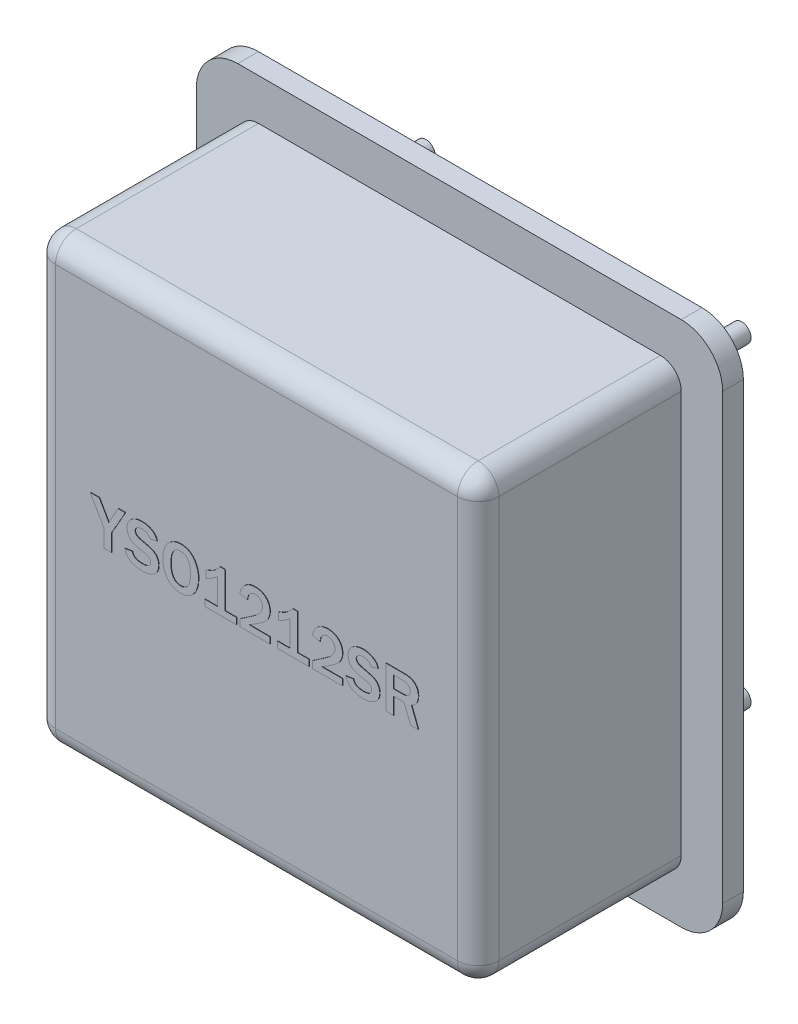
from build123d import *

# Parameters (mm, degrees)
EXTRUDE_1_DEPTH = 0.5
EXTRUDE_2_DEPTH = 4.9
FILLET_1_R      = 0.5
SKETCH_3_R      = 0.225
EXTRUDE_3_DEPTH = 2.5
SKETCH_4_R      = 0.75
EXTRUDE_4_DEPTH = 0.5
FILLET_2_R      = 0.5
WRAP_1_DEPTH    = 0.01


# Read off the part's stored shape, not the designer's step: Перенос1
with BuildPart() as part:
    # Эскиз1 → Бобышка-Вытянуть1 (new body)
    with BuildSketch(Plane.XY):
        with BuildLine():
            Line((-5.35, 6.35), (5.35, 6.35))
            ThreePointArc((5.35, 6.35), (6.057106781, 6.057106781), (6.35, 5.35))
            Line((6.35, 5.35), (6.35, -5.35))
            ThreePointArc((6.35, -5.35), (6.057106781, -6.057106781), (5.35, -6.35))
            Line((5.35, -6.35), (-6.35, -6.35))
            Line((-6.35, -6.35), (-6.35, 5.35))
            ThreePointArc((-6.35, 5.35), (-6.057106781, 6.057106781), (-5.35, 6.35))
        make_face()
    extrude(amount=EXTRUDE_1_DEPTH)

    # Эскиз2 → Бобышка-Вытянуть2 (add)
    with BuildSketch(Plane.XY.offset(0.5)):
        with BuildLine():
            Line((-4.85, 5.35), (4.85, 5.35))
            ThreePointArc((4.85, 5.35), (5.203553391, 5.203553391), (5.35, 4.85))
            Line((5.35, 4.85), (5.35, -4.85))
            ThreePointArc((5.35, -4.85), (5.203553391, -5.203553391), (4.85, -5.35))
            Line((4.85, -5.35), (-4.85, -5.35))
            ThreePointArc((-4.85, -5.35), (-5.203553391, -5.203553391), (-5.35, -4.85))
            Line((-5.35, -4.85), (-5.35, 4.85))
            ThreePointArc((-5.35, 4.85), (-5.203553391, 5.203553391), (-4.85, 5.35))
        make_face()
    extrude(amount=EXTRUDE_2_DEPTH)

    # Скругление1
    fillet_1_edges = [part.edges().sort_by_distance(p)[0] for p in [
        (5.203553391, -5.203553391, 5.4),
        (5.35, 0, 5.4),
        (5.203553391, 5.203553391, 5.4),
        (0, 5.35, 5.4),
        (-5.203553391, 5.203553391, 5.4),
        (-5.35, 0, 5.4),
        (-5.203553391, -5.203553391, 5.4),
        (0, -5.35, 5.4),
    ]]
    fillet(fillet_1_edges, radius=FILLET_1_R)

    # Эскиз3 → Бобышка-Вытянуть3 (add)
    with BuildSketch(Plane(origin=(0, 0, 0), x_dir=(-1, 0, 0), z_dir=(0, 0, -1))):
        with Locations(Location((3.81, -3.81, 0), (0, 0, 180))):
            Circle(SKETCH_3_R)
        with Locations(Location((3.81, 3.81, 0), (0, 0, 180))):
            Circle(SKETCH_3_R)
        with Locations(Location((-3.81, -3.81, 0), (0, 0, 180))):
            Circle(SKETCH_3_R)
        with Locations(Location((-3.81, 3.81, 0), (0, 0, 180))):
            Circle(SKETCH_3_R)
    extrude(amount=EXTRUDE_3_DEPTH)

    # Эскиз4 → Бобышка-Вытянуть4 (add)
    with BuildSketch(Plane(origin=(0, 0, 0), x_dir=(-1, 0, 0), z_dir=(0, 0, -1))):
        with Locations(Location((2.5, -2.15, 0), (0, 0, 180))):
            Circle(SKETCH_4_R)
        with Locations(Location((-2.5, -2.15, 0), (0, 0, 180))):
            Circle(SKETCH_4_R)
        with Locations(Location((0, 2.180127019, 0), (0, 0, 180))):
            Circle(SKETCH_4_R)
    extrude(amount=EXTRUDE_4_DEPTH)

    # Скругление2
    fillet_2_edges = [part.edges().sort_by_distance(p)[0] for p in [
        (-3.25, -2.15, -0.5),
        (1.75, -2.15, -0.5),
        (-0.75, 2.180127019, -0.5),
    ]]
    fillet(fillet_2_edges, radius=FILLET_2_R - 0.0001)  # a hair under: the kernel refuses the full size

    # Перенос1 outline → Перенос1 (add)
    # profile 1 of 9: a face of its own
    with BuildSketch(Plane.XY.offset(5.4)):
        with BuildLine():
            add(Edge.make_bspline(
                [(-2.986111111, -0.205541395), (-2.984703027, -0.211143758), (-2.981915557, -0.222234306), (-2.975864904, -0.238068794), (-2.968090123, -0.252717544), (-2.959313238, -0.266431053), (-2.948882459, -0.278937311), (-2.93724516, -0.290535049), (-2.923776155, -0.300633052), (-2.909324895, -0.310096876), (-2.893210444, -0.318041802), (-2.875896445, -0.325351835), (-2.856970671, -0.330930764), (-2.836846277, -0.336197784), (-2.815165054, -0.339589622), (-2.792173258, -0.342588015), (-2.767738461, -0.343952185), (-2.751013557, -0.344267815), (-2.742404514, -0.344430284)],
                knots=[0, 0, 0, 0, 0.056656455, 0.112158231, 0.165818123, 0.219176659, 0.271620736, 0.325332254, 0.379996961, 0.436510928, 0.494607734, 0.556039301, 0.620703871, 0.688021991, 0.760027589, 0.835837734, 0.915498464, 1, 1, 1, 1], degree=3))
            Line((-2.986111111, -0.205541395), (-3.166666667, -0.233319173))
            add(Edge.make_bspline(
                [(-2.751736111, -0.497208062), (-2.764110633, -0.496966443), (-2.788529481, -0.496489652), (-2.824630575, -0.49370475), (-2.859588786, -0.488782293), (-2.893238195, -0.481498818), (-2.925846185, -0.472667935), (-2.957230248, -0.46159343), (-2.987472, -0.448552519), (-3.016365272, -0.433643986), (-3.043597297, -0.416649458), (-3.068320122, -0.396977926), (-3.090946206, -0.375404973), (-3.111027891, -0.351374956), (-3.128496386, -0.324962932), (-3.144129517, -0.296644428), (-3.156947222, -0.26589491), (-3.163388234, -0.244307186), (-3.166666667, -0.233319173)],
                knots=[0, 0, 0, 0, 0.069752503, 0.137643766, 0.203955587, 0.26857099, 0.331581567, 0.394253518, 0.455983321, 0.517075594, 0.577368024, 0.636589356, 0.69483985, 0.753309691, 0.812679619, 0.873075361, 0.935396176, 1, 1, 1, 1], degree=3))
            add(Edge.make_bspline(
                [(-2.347222222, -0.183840006), (-2.347538263, -0.195723214), (-2.3481543, -0.218886326), (-2.353474783, -0.252692235), (-2.362317744, -0.284471718), (-2.374857764, -0.314323579), (-2.390758215, -0.342273374), (-2.410259093, -0.368262257), (-2.433253851, -0.392326595), (-2.459719085, -0.414102682), (-2.489034471, -0.433441205), (-2.520289135, -0.450725752), (-2.553816333, -0.4651253), (-2.589464636, -0.476676111), (-2.62705902, -0.486145779), (-2.666780055, -0.492504073), (-2.708539615, -0.496511306), (-2.737114257, -0.496972213), (-2.751736111, -0.497208062)],
                knots=[0, 0, 0, 0, 0.061983639, 0.120820401, 0.1780674, 0.233734273, 0.289360173, 0.345456745, 0.402862839, 0.462652237, 0.523901564, 0.585904742, 0.648806961, 0.71398671, 0.78128134, 0.850913491, 0.923711339, 1, 1, 1, 1], degree=3))
            add(Edge.make_bspline(
                [(-2.607421875, 0.095239855), (-2.595014152, 0.091973422), (-2.57110147, 0.085678217), (-2.53706929, 0.074403379), (-2.506313825, 0.06180987), (-2.478524436, 0.04847772), (-2.45401728, 0.033754832), (-2.432942242, 0.017562192), (-2.414542793, 0.000710616), (-2.399758268, -0.017841962), (-2.387504247, -0.037033761), (-2.376728978, -0.05651565), (-2.367525544, -0.076492102), (-2.360286581, -0.097106752), (-2.3542536, -0.118081326), (-2.350189285, -0.139584226), (-2.347768385, -0.161576495), (-2.347405152, -0.176383137), (-2.347222222, -0.183840006)],
                knots=[0, 0, 0, 0, 0.092116656, 0.177531073, 0.257205756, 0.330614787, 0.39867412, 0.462046827, 0.521209535, 0.577346543, 0.631807585, 0.68458034, 0.737112251, 0.789523325, 0.841323381, 0.893685527, 0.946458281, 1, 1, 1, 1], degree=3))
            Line((-2.607421875, 0.095239855), (-2.77734375, 0.137340549))
            add(Edge.make_bspline(
                [(-2.916666667, 0.255396105), (-2.916269492, 0.248611769), (-2.915485562, 0.235221068), (-2.908561518, 0.216051008), (-2.897409674, 0.198477655), (-2.881618182, 0.182836807), (-2.861663953, 0.168878577), (-2.837453939, 0.156561619), (-2.808961336, 0.1458125), (-2.788251664, 0.140263331), (-2.77734375, 0.137340549)],
                knots=[0, 0, 0, 0, 0.102807647, 0.202918366, 0.305679, 0.416820913, 0.538203089, 0.674374599, 0.828491055, 1, 1, 1, 1], degree=3))
            add(Edge.make_bspline(
                [(-2.741970486, 0.377791938), (-2.748848382, 0.377760144), (-2.762194325, 0.377698452), (-2.781586671, 0.375746501), (-2.799844152, 0.373392555), (-2.816767582, 0.369351016), (-2.83248431, 0.364661202), (-2.846965698, 0.358865667), (-2.85998442, 0.351547293), (-2.875600538, 0.341225743), (-2.891862654, 0.325930945), (-2.906115374, 0.304623595), (-2.9152112, 0.280830292), (-2.916173526, 0.264013713), (-2.916666667, 0.255396105)],
                knots=[0, 0, 0, 0, 0.086267162, 0.167393738, 0.24442942, 0.317104737, 0.385455065, 0.450194837, 0.51236268, 0.572543169, 0.684932717, 0.789681103, 0.892222673, 1, 1, 1, 1], degree=3))
            add(Edge.make_bspline(
                [(-2.555555556, 0.266680827), (-2.559167594, 0.275509598), (-2.566205498, 0.292712088), (-2.581523587, 0.315587721), (-2.599994318, 0.335111156), (-2.622083202, 0.350855882), (-2.647413374, 0.363084862), (-2.67603835, 0.371697219), (-2.707926665, 0.37690584), (-2.730303134, 0.377488258), (-2.741970486, 0.377791938)],
                knots=[0, 0, 0, 0, 0.122482514, 0.238652039, 0.351887163, 0.466581876, 0.585638956, 0.712239674, 0.849958408, 1, 1, 1, 1], degree=3))
            Line((-2.555555556, 0.266680827), (-2.388888889, 0.308347494))
            add(Edge.make_bspline(
                [(-2.752604167, 0.530569716), (-2.741891214, 0.530427824), (-2.720716278, 0.530147365), (-2.689347139, 0.527160052), (-2.658833251, 0.522679452), (-2.629152016, 0.51641985), (-2.60047327, 0.508107734), (-2.572638241, 0.498111963), (-2.545605635, 0.486415709), (-2.519766807, 0.472764364), (-2.495263745, 0.457823252), (-2.473023163, 0.440958229), (-2.452922031, 0.422828534), (-2.435459435, 0.402835509), (-2.420195497, 0.381466578), (-2.407056342, 0.358655027), (-2.396578147, 0.334127097), (-2.391473128, 0.317011615), (-2.388888889, 0.308347494)],
                knots=[0, 0, 0, 0, 0.070067612, 0.138493765, 0.205959035, 0.271768989, 0.336775966, 0.401145877, 0.465152901, 0.529294502, 0.592202089, 0.652684629, 0.71164265, 0.768984917, 0.825980465, 0.883213263, 0.940880749, 1, 1, 1, 1], degree=3))
            add(Edge.make_bspline(
                [(-3.111111111, 0.226967285), (-3.110859993, 0.238199634), (-3.110369912, 0.260120678), (-3.105347953, 0.292100068), (-3.097694804, 0.322443015), (-3.086480776, 0.351013678), (-3.072361228, 0.377982258), (-3.054727968, 0.403015799), (-3.034353993, 0.426659442), (-3.010544587, 0.447934082), (-2.984676049, 0.467401329), (-2.956778913, 0.484524021), (-2.926878656, 0.498453247), (-2.895454551, 0.51037159), (-2.862221676, 0.519373241), (-2.827248807, 0.525894435), (-2.790528439, 0.529856788), (-2.76541793, 0.530328834), (-2.752604167, 0.530569716)],
                knots=[0, 0, 0, 0, 0.06383965, 0.124589417, 0.183667869, 0.241508339, 0.298748618, 0.35638825, 0.415298831, 0.47588396, 0.537601361, 0.599274858, 0.661666101, 0.724943745, 0.790224303, 0.857203403, 0.927131637, 1, 1, 1, 1], degree=3))
            add(Edge.make_bspline(
                [(-2.860026042, -0.057103895), (-2.875564765, -0.052736166), (-2.90465406, -0.044559551), (-2.944754037, -0.030238306), (-2.978475048, -0.01514703), (-3.006514424, 0.001525324), (-3.029965576, 0.020572727), (-3.049941477, 0.042955693), (-3.068173284, 0.068167692), (-3.083346768, 0.096780218), (-3.095634735, 0.127571076), (-3.104485583, 0.15981657), (-3.11020428, 0.193054624), (-3.110806794, 0.215586775), (-3.111111111, 0.226967285)],
                knots=[0, 0, 0, 0, 0.116476583, 0.21805019, 0.307066431, 0.382731705, 0.452862203, 0.524195224, 0.598669358, 0.676927554, 0.757304679, 0.837489942, 0.917919621, 1, 1, 1, 1], degree=3))
            Line((-2.860026042, -0.057103895), (-2.666883681, -0.09920459))
            add(Edge.make_bspline(
                [(-2.541666667, -0.220732367), (-2.541972804, -0.214487169), (-2.542581854, -0.202062548), (-2.547080739, -0.183778017), (-2.554569311, -0.166288707), (-2.563180197, -0.152425169), (-2.572125226, -0.141976219), (-2.580582698, -0.134349689), (-2.590995974, -0.127563678), (-2.602718477, -0.120628267), (-2.616444755, -0.114767493), (-2.631751469, -0.109137854), (-2.648631593, -0.103604153), (-2.660638764, -0.100709892), (-2.666883681, -0.09920459)],
                knots=[0, 0, 0, 0, 0.097850119, 0.194669652, 0.293246512, 0.395184179, 0.44906011, 0.50848649, 0.572967504, 0.643579243, 0.721762348, 0.806444209, 0.899331843, 1, 1, 1, 1], degree=3))
            add(Edge.make_bspline(
                [(-2.742404514, -0.344430284), (-2.734590713, -0.344268685), (-2.719382705, -0.343954163), (-2.697261594, -0.342579327), (-2.676545615, -0.339690236), (-2.657242377, -0.335865446), (-2.63931987, -0.330860412), (-2.622762159, -0.324789972), (-2.607528949, -0.317691797), (-2.593817003, -0.309417949), (-2.58164126, -0.300285015), (-2.570985726, -0.290576914), (-2.561947224, -0.280247049), (-2.554507414, -0.269426432), (-2.548851346, -0.25799478), (-2.544590245, -0.246157521), (-2.542204706, -0.23363115), (-2.541848107, -0.22508215), (-2.541666667, -0.220732367)],
                knots=[0, 0, 0, 0, 0.089511101, 0.174215532, 0.253655289, 0.328883544, 0.399441257, 0.466543583, 0.53065905, 0.591613395, 0.64960748, 0.704725214, 0.756397831, 0.806492182, 0.854658561, 0.902085367, 0.950180442, 1, 1, 1, 1], degree=3))
        make_face()
    # profile 2 of 9: a face of its own
    with BuildSketch(Plane.XY.offset(5.4)):
        with BuildLine():
            add(Edge.make_bspline(
                [(-2.25, 0.019936035), (-2.249602085, 0.037744558), (-2.24882216, 0.072649845), (-2.24336955, 0.123899627), (-2.234115815, 0.172928317), (-2.220746375, 0.219691607), (-2.204120729, 0.264353208), (-2.183620114, 0.306752501), (-2.159157955, 0.346780218), (-2.131389463, 0.384364876), (-2.100547397, 0.418593081), (-2.0669495, 0.448644799), (-2.03074927, 0.473880029), (-1.992270196, 0.494724255), (-1.951384189, 0.510841963), (-1.908151491, 0.522388423), (-1.862481646, 0.529152355), (-1.831258104, 0.530090748), (-1.815321181, 0.530569716)],
                knots=[0, 0, 0, 0, 0.071125345, 0.139408001, 0.205594729, 0.270167463, 0.333439417, 0.395725999, 0.457964312, 0.520548402, 0.582121204, 0.641675985, 0.700189245, 0.75797679, 0.816084163, 0.8753072, 0.936355088, 1, 1, 1, 1], degree=3))
            add(Edge.make_bspline(
                [(-1.823567708, -0.497208062), (-1.839943553, -0.496762162), (-1.871908019, -0.495891797), (-1.918385874, -0.488742109), (-1.962220666, -0.477475092), (-2.002996519, -0.460630717), (-2.041351429, -0.439921436), (-2.076492307, -0.413868816), (-2.109098681, -0.38355586), (-2.138378166, -0.348589686), (-2.164371459, -0.31020632), (-2.187547533, -0.269604513), (-2.206921006, -0.226654835), (-2.222465475, -0.181481133), (-2.234897651, -0.13427391), (-2.243787932, -0.084797301), (-2.249024569, -0.033129477), (-2.249671344, 0.00205647), (-2.25, 0.019936035)],
                knots=[0, 0, 0, 0, 0.065202683, 0.127270924, 0.186893503, 0.245060999, 0.302579602, 0.360101092, 0.418820591, 0.479552624, 0.541337256, 0.603279609, 0.665572875, 0.72872865, 0.793382023, 0.859854191, 0.928785597, 1, 1, 1, 1], degree=3))
            add(Edge.make_bspline(
                [(-1.388888889, 0.017765896), (-1.389284748, -0.001054276), (-1.390056853, -0.03776223), (-1.395468885, -0.091475409), (-1.404807867, -0.14241125), (-1.417731955, -0.19065894), (-1.434481727, -0.23618984), (-1.455204638, -0.278765282), (-1.479313648, -0.318819371), (-1.507254408, -0.355561049), (-1.538186675, -0.388690096), (-1.571588747, -0.417883448), (-1.607479249, -0.442609995), (-1.646168098, -0.462405451), (-1.687017878, -0.478154293), (-1.730439143, -0.489139236), (-1.776178076, -0.496090681), (-1.80755522, -0.49683051), (-1.823567708, -0.497208062)],
                knots=[0, 0, 0, 0, 0.074502731, 0.14531444, 0.213448803, 0.279305653, 0.342822724, 0.405198466, 0.466492606, 0.527606518, 0.587580546, 0.645636819, 0.702908012, 0.759649061, 0.817301328, 0.875854836, 0.936645827, 1, 1, 1, 1], degree=3))
            add(Edge.make_bspline(
                [(-1.815321181, 0.530569716), (-1.799312872, 0.530087325), (-1.767947213, 0.529142158), (-1.722188712, 0.522445666), (-1.67904383, 0.510824414), (-1.638463231, 0.494816851), (-1.600562053, 0.473917177), (-1.565201839, 0.448608443), (-1.53246359, 0.418627619), (-1.502727607, 0.384311198), (-1.475925606, 0.346727815), (-1.452714339, 0.306383622), (-1.432837667, 0.263955562), (-1.416756154, 0.219108879), (-1.404156712, 0.172002944), (-1.39541902, 0.12255271), (-1.389767021, 0.07092116), (-1.38918551, 0.03572104), (-1.388888889, 0.017765896)],
                knots=[0, 0, 0, 0, 0.064146068, 0.125683714, 0.18482368, 0.242854803, 0.300070672, 0.357831807, 0.416723283, 0.477537663, 0.539477544, 0.601432348, 0.663814321, 0.726996098, 0.792111536, 0.858982425, 0.928068687, 1, 1, 1, 1], degree=3))
        make_face()
        with BuildLine():
            add(Edge.make_bspline(
                [(-1.583333333, 0.019284994), (-1.583497722, 0.032888129), (-1.583818072, 0.059397143), (-1.586363174, 0.098022372), (-1.59094858, 0.134382123), (-1.597143152, 0.168466749), (-1.605199849, 0.200291442), (-1.6148174, 0.229913037), (-1.626643399, 0.257161734), (-1.640000035, 0.282158073), (-1.655156898, 0.304785566), (-1.672514249, 0.324369703), (-1.691935539, 0.340964583), (-1.713288502, 0.354457313), (-1.736675951, 0.36497986), (-1.761960819, 0.372626235), (-1.789350999, 0.376910024), (-1.808217455, 0.377492315), (-1.817925347, 0.377791938)],
                knots=[0, 0, 0, 0, 0.084326336, 0.16433035, 0.239810088, 0.311406626, 0.378949026, 0.443189149, 0.504251522, 0.562839855, 0.618686746, 0.672686415, 0.724537347, 0.776541251, 0.828722736, 0.883058393, 0.939826723, 1, 1, 1, 1], degree=3))
            add(Edge.make_bspline(
                [(-1.821614583, -0.344430284), (-1.813425102, -0.34417673), (-1.797323277, -0.343678202), (-1.773690016, -0.339832136), (-1.750924338, -0.333843067), (-1.729260481, -0.32501059), (-1.708282207, -0.314170061), (-1.688671572, -0.300346993), (-1.669804256, -0.284352561), (-1.651817858, -0.265857778), (-1.635321778, -0.243954041), (-1.621228917, -0.218068287), (-1.609594879, -0.188110154), (-1.599973932, -0.15431442), (-1.592427336, -0.116502766), (-1.587157825, -0.074805429), (-1.583884559, -0.029089141), (-1.583522164, 0.002713674), (-1.583333333, 0.019284994)],
                knots=[0, 0, 0, 0, 0.049960708, 0.098230702, 0.145782593, 0.193334483, 0.2407324, 0.289598405, 0.339402802, 0.39154752, 0.446736047, 0.50621525, 0.57082044, 0.642504028, 0.720432417, 0.805917575, 0.898870521, 1, 1, 1, 1], degree=3))
            add(Edge.make_bspline(
                [(-2.055555556, 0.01407666), (-2.055414964, -0.000178821), (-2.055142046, -0.027851675), (-2.052301301, -0.067989207), (-2.047592874, -0.105536387), (-2.040888356, -0.140395486), (-2.03256183, -0.172666426), (-2.022082541, -0.202215073), (-2.009782753, -0.229114), (-1.995714643, -0.253462517), (-1.97956609, -0.274781659), (-1.961925535, -0.293410182), (-1.942662832, -0.309254908), (-1.921633763, -0.322178319), (-1.898906852, -0.332160839), (-1.874581461, -0.339429342), (-1.848587394, -0.343483743), (-1.830742641, -0.344109959), (-1.821614583, -0.344430284)],
                knots=[0, 0, 0, 0, 0.088592987, 0.171977415, 0.249941733, 0.323659878, 0.392474925, 0.456895932, 0.518256837, 0.576091754, 0.631305128, 0.684096475, 0.735218646, 0.785882027, 0.837012106, 0.88907856, 0.943260784, 1, 1, 1, 1], degree=3))
            add(Edge.make_bspline(
                [(-1.817925347, 0.377791938), (-1.827559359, 0.377476161), (-1.846267725, 0.376862951), (-1.873414328, 0.372812525), (-1.898611997, 0.365558158), (-1.922006676, 0.35559795), (-1.943515583, 0.342620484), (-1.963177051, 0.326827197), (-1.98111186, 0.30833687), (-1.99674963, 0.286718875), (-2.010717088, 0.26243068), (-2.022775956, 0.235283625), (-2.032963147, 0.205263056), (-2.041348943, 0.172543879), (-2.047858897, 0.136938992), (-2.052227697, 0.098510316), (-2.055165628, 0.05723577), (-2.055422835, 0.028766789), (-2.055555556, 0.01407666)],
                knots=[0, 0, 0, 0, 0.058737271, 0.114062397, 0.166826911, 0.218192389, 0.268640894, 0.319471569, 0.371559004, 0.425190037, 0.481697829, 0.54210513, 0.605981978, 0.674761805, 0.747855996, 0.826464593, 0.910454911, 1, 1, 1, 1], degree=3))
        make_face(mode=Mode.SUBTRACT)
    # profile 3 of 9: a face of its own
    with BuildSketch(Plane.XY.offset(5.4)):
        with BuildLine():
            add(Edge.make_bspline(
                [(-0.930555556, 0.294241591), (-0.942944983, 0.283690121), (-0.967169302, 0.263059451), (-1.003502312, 0.233918043), (-1.039226876, 0.207755007), (-1.07372786, 0.183581227), (-1.107721672, 0.162446221), (-1.140824815, 0.143737145), (-1.17280592, 0.127186482), (-1.194379698, 0.118246469), (-1.204861111, 0.113903049)],
                knots=[0, 0, 0, 0, 0.148058968, 0.289491008, 0.423624862, 0.550871495, 0.672677906, 0.787617792, 0.896816138, 1, 1, 1, 1], degree=3))
            Line((-0.930555556, 0.294241591), (-0.930555556, -0.330541395))
            Line((-0.930555556, -0.330541395), (-1.236111111, -0.330541395))
            Line((-1.236111111, -0.330541395), (-1.236111111, -0.483319173))
            Line((-1.236111111, -0.483319173), (-0.472222222, -0.483319173))
            Line((-0.472222222, -0.483319173), (-0.472222222, -0.330541395))
            Line((-0.472222222, -0.330541395), (-0.75, -0.330541395))
            Line((-0.75, -0.330541395), (-0.75, 0.530569716))
            Line((-0.75, 0.530569716), (-0.870225694, 0.530569716))
            add(Edge.make_bspline(
                [(-1.204861111, 0.294458605), (-1.19488116, 0.298227048), (-1.175927128, 0.305384115), (-1.148914187, 0.315462843), (-1.125025516, 0.325089261), (-1.103981132, 0.333781184), (-1.085709191, 0.341422838), (-1.070626332, 0.348682288), (-1.0582516, 0.354635724), (-1.045120111, 0.362335337), (-1.028978153, 0.37349786), (-1.007907349, 0.389825888), (-0.983034425, 0.410184845), (-0.955654579, 0.43356997), (-0.9283494, 0.458331772), (-0.904731787, 0.483405251), (-0.884939714, 0.506757976), (-0.874903888, 0.522998983), (-0.870225694, 0.530569716)],
                knots=[0, 0, 0, 0, 0.076578495, 0.145438706, 0.206959063, 0.261443328, 0.308899468, 0.349085426, 0.381597164, 0.407425535, 0.458266745, 0.522348273, 0.598745212, 0.688975075, 0.780844148, 0.863122565, 0.936194682, 1, 1, 1, 1], degree=3))
            Line((-1.204861111, 0.294458605), (-1.204861111, 0.113903049))
        make_face()
    # profile 4 of 9: a face of its own
    with BuildSketch(Plane.XY.offset(5.4)):
        with BuildLine():
            add(Edge.make_bspline(
                [(-0.084201389, -0.109404242), (-0.072795673, -0.101515208), (-0.050715973, -0.08624326), (-0.01955958, -0.063037274), (0.008871174, -0.040686988), (0.034165829, -0.018837017), (0.056660309, 0.002257746), (0.076277574, 0.022574321), (0.092893064, 0.042370853), (0.110670047, 0.067231457), (0.128038352, 0.097438481), (0.143797914, 0.132581346), (0.153670819, 0.166538725), (0.154971666, 0.188859875), (0.155598958, 0.199623535)],
                knots=[0, 0, 0, 0, 0.102488525, 0.198401914, 0.287074603, 0.369708942, 0.44535091, 0.514926661, 0.578313457, 0.636174539, 0.740618928, 0.835181779, 0.920521691, 1, 1, 1, 1], degree=3))
            Line((-0.084201389, -0.109404242), (-0.388888889, -0.316652506))
            Line((-0.388888889, -0.316652506), (-0.388888889, -0.483319173))
            Line((-0.388888889, -0.483319173), (0.333333333, -0.483319173))
            Line((0.333333333, -0.483319173), (0.333333333, -0.330541395))
            Line((0.333333333, -0.330541395), (-0.165798611, -0.330541395))
            add(Edge.make_bspline(
                [(0.336154514, 0.196585341), (0.33590307, 0.186013376), (0.335405321, 0.165085549), (0.331468199, 0.134110601), (0.324593133, 0.104116703), (0.31561615, 0.074811387), (0.30340477, 0.046576287), (0.289255982, 0.018863371), (0.271869375, -0.00764057), (0.255352161, -0.029136214), (0.240178263, -0.046390066), (0.226584778, -0.06002637), (0.211233976, -0.07457456), (0.193754107, -0.089720772), (0.174503814, -0.105796868), (0.153219351, -0.12240657), (0.130105887, -0.139894366), (0.104929611, -0.158027931), (0.07786023, -0.177139656), (0.048771542, -0.196885114), (0.017686183, -0.2171698), (-0.01506973, -0.238613649), (-0.050070066, -0.26039873), (-0.086854478, -0.283171242), (-0.125620381, -0.306696934), (-0.152185414, -0.322462409), (-0.165798611, -0.330541395)],
                knots=[0, 0, 0, 0, 0.041495428, 0.082142639, 0.122307868, 0.162185965, 0.202270804, 0.242915039, 0.284189302, 0.326505472, 0.349239486, 0.37434042, 0.402062602, 0.432249619, 0.465118487, 0.500510775, 0.538222901, 0.578893913, 0.622305037, 0.668302943, 0.716899285, 0.768018831, 0.821990626, 0.878732468, 0.937856699, 1, 1, 1, 1], degree=3))
            add(Edge.make_bspline(
                [(-0.019965278, 0.530569716), (-0.006787747, 0.530272378), (0.018989788, 0.529690735), (0.056682239, 0.525308018), (0.092381773, 0.518029442), (0.12593597, 0.507549637), (0.157485597, 0.494307136), (0.186867056, 0.477883847), (0.214439775, 0.458802433), (0.239442469, 0.436563545), (0.262239746, 0.412405255), (0.28209545, 0.386321977), (0.298621172, 0.35849138), (0.312468874, 0.329267841), (0.323075557, 0.298316471), (0.330643679, 0.265819006), (0.335333026, 0.231733645), (0.335876884, 0.208464076), (0.336154514, 0.196585341)],
                knots=[0, 0, 0, 0, 0.072015998, 0.140875782, 0.207100257, 0.2708811, 0.332716646, 0.393780021, 0.454548246, 0.515624421, 0.576327007, 0.635875079, 0.694395607, 0.752942845, 0.812338446, 0.872856601, 0.935095366, 1, 1, 1, 1], degree=3))
            add(Edge.make_bspline(
                [(-0.388888889, 0.211125271), (-0.387040987, 0.221941015), (-0.383374683, 0.24339984), (-0.374799288, 0.274672939), (-0.363970362, 0.304744751), (-0.350613381, 0.333531755), (-0.334971054, 0.3612574), (-0.316672212, 0.387649448), (-0.296139857, 0.413029867), (-0.27334441, 0.436990458), (-0.248271561, 0.458874144), (-0.221191531, 0.478131105), (-0.192255245, 0.494444005), (-0.161427593, 0.507796276), (-0.12865599, 0.517933439), (-0.094094365, 0.525314006), (-0.05762074, 0.529689324), (-0.032708722, 0.530271772), (-0.019965278, 0.530569716)],
                knots=[0, 0, 0, 0, 0.061474734, 0.121968095, 0.181484621, 0.240447441, 0.299644032, 0.359705053, 0.42024596, 0.482480917, 0.544847828, 0.60650283, 0.668415966, 0.730710337, 0.794448858, 0.860378466, 0.928578281, 1, 1, 1, 1], degree=3))
            Line((-0.388888889, 0.211125271), (-0.208333333, 0.169458605))
            add(Edge.make_bspline(
                [(-0.016276042, 0.377791938), (-0.023082466, 0.377616298), (-0.036304643, 0.377275099), (-0.05564632, 0.374879181), (-0.073802583, 0.370763144), (-0.090950421, 0.365155569), (-0.106830686, 0.357679941), (-0.121762821, 0.348785304), (-0.135431212, 0.338037635), (-0.148172982, 0.325820732), (-0.159607806, 0.311824279), (-0.170184852, 0.29637898), (-0.179118333, 0.27904402), (-0.187544433, 0.260383599), (-0.194327166, 0.239898976), (-0.200216506, 0.217875955), (-0.204979643, 0.194242557), (-0.2071959, 0.177864297), (-0.208333333, 0.169458605)],
                knots=[0, 0, 0, 0, 0.064616556, 0.125524294, 0.184671911, 0.241139137, 0.296445882, 0.350979668, 0.405793836, 0.461164507, 0.518234122, 0.577093953, 0.63854139, 0.703114134, 0.771310552, 0.843111998, 0.919481536, 1, 1, 1, 1], degree=3))
            add(Edge.make_bspline(
                [(0.155598958, 0.199623535), (0.15551753, 0.205781778), (0.155356894, 0.217930398), (0.152783685, 0.235695222), (0.149171358, 0.252785991), (0.143972093, 0.269087815), (0.137159026, 0.284620244), (0.128935915, 0.29941681), (0.119045903, 0.313395976), (0.107822337, 0.326503467), (0.095611228, 0.338644089), (0.08230061, 0.349155759), (0.067951559, 0.357885588), (0.052881106, 0.365265173), (0.036811359, 0.371028062), (0.019885825, 0.374784316), (0.002099453, 0.377292382), (-0.010045961, 0.377622567), (-0.016276042, 0.377791938)],
                knots=[0, 0, 0, 0, 0.06659456, 0.131373857, 0.193879822, 0.255536535, 0.31619585, 0.377187768, 0.438445469, 0.501205922, 0.563770706, 0.624546135, 0.684304329, 0.745235909, 0.805910381, 0.86858775, 0.932591105, 1, 1, 1, 1], degree=3))
        make_face()
    # profile 5 of 9: a face of its own
    with BuildSketch(Plane.XY.offset(5.4)):
        with BuildLine():
            add(Edge.make_bspline(
                [(0.819444444, 0.294241591), (0.807055017, 0.283690121), (0.782830698, 0.263059451), (0.746497688, 0.233918043), (0.710773124, 0.207755007), (0.67627214, 0.183581227), (0.642278328, 0.162446221), (0.609175185, 0.143737145), (0.57719408, 0.127186482), (0.555620302, 0.118246469), (0.545138889, 0.113903049)],
                knots=[0, 0, 0, 0, 0.148058968, 0.289491008, 0.423624862, 0.550871495, 0.672677906, 0.787617792, 0.896816138, 1, 1, 1, 1], degree=3))
            Line((0.819444444, 0.294241591), (0.819444444, -0.330541395))
            Line((0.819444444, -0.330541395), (0.513888889, -0.330541395))
            Line((0.513888889, -0.330541395), (0.513888889, -0.483319173))
            Line((0.513888889, -0.483319173), (1.277777778, -0.483319173))
            Line((1.277777778, -0.483319173), (1.277777778, -0.330541395))
            Line((1.277777778, -0.330541395), (1, -0.330541395))
            Line((1, -0.330541395), (1, 0.530569716))
            Line((1, 0.530569716), (0.879774306, 0.530569716))
            add(Edge.make_bspline(
                [(0.545138889, 0.294458605), (0.55511884, 0.298227048), (0.574072872, 0.305384115), (0.601085813, 0.315462843), (0.624974484, 0.325089261), (0.646018868, 0.333781184), (0.664290809, 0.341422838), (0.679373668, 0.348682288), (0.6917484, 0.354635724), (0.704879889, 0.362335337), (0.721021847, 0.37349786), (0.742092651, 0.389825888), (0.766965575, 0.410184845), (0.794345421, 0.43356997), (0.8216506, 0.458331772), (0.845268213, 0.483405251), (0.865060286, 0.506757976), (0.875096112, 0.522998983), (0.879774306, 0.530569716)],
                knots=[0, 0, 0, 0, 0.076578495, 0.145438706, 0.206959063, 0.261443328, 0.308899468, 0.349085426, 0.381597164, 0.407425535, 0.458266745, 0.522348273, 0.598745212, 0.688975075, 0.780844148, 0.863122565, 0.936194682, 1, 1, 1, 1], degree=3))
            Line((0.545138889, 0.294458605), (0.545138889, 0.113903049))
        make_face()
    # profile 6 of 9: a face of its own
    with BuildSketch(Plane.XY.offset(5.4)):
        with BuildLine():
            add(Edge.make_bspline(
                [(1.665798611, -0.109404242), (1.677204327, -0.101515208), (1.699284027, -0.08624326), (1.73044042, -0.063037274), (1.758871174, -0.040686988), (1.784165829, -0.018837017), (1.806660309, 0.002257746), (1.826277574, 0.022574321), (1.842893064, 0.042370853), (1.860670047, 0.067231457), (1.878038352, 0.097438481), (1.893797914, 0.132581346), (1.903670819, 0.166538725), (1.904971666, 0.188859875), (1.905598958, 0.199623535)],
                knots=[0, 0, 0, 0, 0.102488525, 0.198401914, 0.287074603, 0.369708942, 0.44535091, 0.514926661, 0.578313457, 0.636174539, 0.740618928, 0.835181779, 0.920521691, 1, 1, 1, 1], degree=3))
            Line((1.665798611, -0.109404242), (1.361111111, -0.316652506))
            Line((1.361111111, -0.316652506), (1.361111111, -0.483319173))
            Line((1.361111111, -0.483319173), (2.083333333, -0.483319173))
            Line((2.083333333, -0.483319173), (2.083333333, -0.330541395))
            Line((2.083333333, -0.330541395), (1.584201389, -0.330541395))
            add(Edge.make_bspline(
                [(2.086154514, 0.196585341), (2.08590307, 0.186013376), (2.085405321, 0.165085549), (2.081468199, 0.134110601), (2.074593133, 0.104116703), (2.06561615, 0.074811387), (2.05340477, 0.046576287), (2.039255982, 0.018863371), (2.021869375, -0.00764057), (2.005352161, -0.029136214), (1.990178263, -0.046390066), (1.976584778, -0.06002637), (1.961233976, -0.07457456), (1.943754107, -0.089720772), (1.924503814, -0.105796868), (1.903219351, -0.12240657), (1.880105887, -0.139894366), (1.854929611, -0.158027931), (1.82786023, -0.177139656), (1.798771542, -0.196885114), (1.767686183, -0.2171698), (1.73493027, -0.238613649), (1.699929934, -0.26039873), (1.663145522, -0.283171242), (1.624379619, -0.306696934), (1.597814586, -0.322462409), (1.584201389, -0.330541395)],
                knots=[0, 0, 0, 0, 0.041495428, 0.082142639, 0.122307868, 0.162185965, 0.202270804, 0.242915039, 0.284189302, 0.326505472, 0.349239486, 0.37434042, 0.402062602, 0.432249619, 0.465118487, 0.500510775, 0.538222901, 0.578893913, 0.622305037, 0.668302943, 0.716899285, 0.768018831, 0.821990626, 0.878732468, 0.937856699, 1, 1, 1, 1], degree=3))
            add(Edge.make_bspline(
                [(1.730034722, 0.530569716), (1.743212253, 0.530272378), (1.768989788, 0.529690735), (1.806682239, 0.525308018), (1.842381773, 0.518029442), (1.87593597, 0.507549637), (1.907485597, 0.494307136), (1.936867056, 0.477883847), (1.964439775, 0.458802433), (1.989442469, 0.436563545), (2.012239746, 0.412405255), (2.03209545, 0.386321977), (2.048621172, 0.35849138), (2.062468874, 0.329267841), (2.073075557, 0.298316471), (2.080643679, 0.265819006), (2.085333026, 0.231733645), (2.085876884, 0.208464076), (2.086154514, 0.196585341)],
                knots=[0, 0, 0, 0, 0.072015998, 0.140875782, 0.207100257, 0.2708811, 0.332716646, 0.393780021, 0.454548246, 0.515624421, 0.576327007, 0.635875079, 0.694395607, 0.752942845, 0.812338446, 0.872856601, 0.935095366, 1, 1, 1, 1], degree=3))
            add(Edge.make_bspline(
                [(1.361111111, 0.211125271), (1.362959013, 0.221941015), (1.366625317, 0.24339984), (1.375200712, 0.274672939), (1.386029638, 0.304744751), (1.399386619, 0.333531755), (1.415028946, 0.3612574), (1.433327788, 0.387649448), (1.453860143, 0.413029867), (1.47665559, 0.436990458), (1.501728439, 0.458874144), (1.528808469, 0.478131105), (1.557744755, 0.494444005), (1.588572407, 0.507796276), (1.62134401, 0.517933439), (1.655905635, 0.525314006), (1.69237926, 0.529689324), (1.717291278, 0.530271772), (1.730034722, 0.530569716)],
                knots=[0, 0, 0, 0, 0.061474734, 0.121968095, 0.181484621, 0.240447441, 0.299644032, 0.359705053, 0.42024596, 0.482480917, 0.544847828, 0.60650283, 0.668415966, 0.730710337, 0.794448858, 0.860378466, 0.928578281, 1, 1, 1, 1], degree=3))
            Line((1.361111111, 0.211125271), (1.541666667, 0.169458605))
            add(Edge.make_bspline(
                [(1.733723958, 0.377791938), (1.726917534, 0.377616298), (1.713695357, 0.377275099), (1.69435368, 0.374879181), (1.676197417, 0.370763144), (1.659049579, 0.365155569), (1.643169314, 0.357679941), (1.628237179, 0.348785304), (1.614568788, 0.338037635), (1.601827018, 0.325820732), (1.590392194, 0.311824279), (1.579815148, 0.29637898), (1.570881667, 0.27904402), (1.562455567, 0.260383599), (1.555672834, 0.239898976), (1.549783494, 0.217875955), (1.545020357, 0.194242557), (1.5428041, 0.177864297), (1.541666667, 0.169458605)],
                knots=[0, 0, 0, 0, 0.064616556, 0.125524294, 0.184671911, 0.241139137, 0.296445882, 0.350979668, 0.405793836, 0.461164507, 0.518234122, 0.577093953, 0.63854139, 0.703114134, 0.771310552, 0.843111998, 0.919481536, 1, 1, 1, 1], degree=3))
            add(Edge.make_bspline(
                [(1.905598958, 0.199623535), (1.90551753, 0.205781778), (1.905356894, 0.217930398), (1.902783685, 0.235695222), (1.899171358, 0.252785991), (1.893972093, 0.269087815), (1.887159026, 0.284620244), (1.878935915, 0.29941681), (1.869045903, 0.313395976), (1.857822337, 0.326503467), (1.845611228, 0.338644089), (1.83230061, 0.349155759), (1.817951559, 0.357885588), (1.802881106, 0.365265173), (1.786811359, 0.371028062), (1.769885825, 0.374784316), (1.752099453, 0.377292382), (1.739954039, 0.377622567), (1.733723958, 0.377791938)],
                knots=[0, 0, 0, 0, 0.06659456, 0.131373857, 0.193879822, 0.255536535, 0.31619585, 0.377187768, 0.438445469, 0.501205922, 0.563770706, 0.624546135, 0.684304329, 0.745235909, 0.805910381, 0.86858775, 0.932591105, 1, 1, 1, 1], degree=3))
        make_face()
    # profile 7 of 9: a face of its own
    with BuildSketch(Plane.XY.offset(5.4)):
        with BuildLine():
            add(Edge.make_bspline(
                [(2.347222222, -0.205541395), (2.348630306, -0.211143758), (2.351417776, -0.222234306), (2.35746843, -0.238068794), (2.36524321, -0.252717544), (2.374020096, -0.266431053), (2.384450874, -0.278937311), (2.396088173, -0.290535049), (2.409557178, -0.300633052), (2.424008439, -0.310096876), (2.440122889, -0.318041802), (2.457436888, -0.325351835), (2.476362662, -0.330930764), (2.496487056, -0.336197784), (2.518168279, -0.339589622), (2.541160075, -0.342588015), (2.565594872, -0.343952185), (2.582319776, -0.344267815), (2.590928819, -0.344430284)],
                knots=[0, 0, 0, 0, 0.056656455, 0.112158231, 0.165818123, 0.219176659, 0.271620736, 0.325332254, 0.379996961, 0.436510928, 0.494607734, 0.556039301, 0.620703871, 0.688021991, 0.760027589, 0.835837734, 0.915498464, 1, 1, 1, 1], degree=3))
            Line((2.347222222, -0.205541395), (2.166666667, -0.233319173))
            add(Edge.make_bspline(
                [(2.581597222, -0.497208062), (2.5692227, -0.496966443), (2.544803852, -0.496489652), (2.508702758, -0.49370475), (2.473744547, -0.488782293), (2.440095138, -0.481498818), (2.407487148, -0.472667935), (2.376103085, -0.46159343), (2.345861334, -0.448552519), (2.316968062, -0.433643986), (2.289736036, -0.416649458), (2.265013212, -0.396977926), (2.242387128, -0.375404973), (2.222305442, -0.351374956), (2.204836947, -0.324962932), (2.189203816, -0.296644428), (2.176386111, -0.26589491), (2.1699451, -0.244307186), (2.166666667, -0.233319173)],
                knots=[0, 0, 0, 0, 0.069752503, 0.137643766, 0.203955587, 0.26857099, 0.331581567, 0.394253518, 0.455983321, 0.517075594, 0.577368024, 0.636589356, 0.69483985, 0.753309691, 0.812679619, 0.873075361, 0.935396176, 1, 1, 1, 1], degree=3))
            add(Edge.make_bspline(
                [(2.986111111, -0.183840006), (2.98579507, -0.195723214), (2.985179034, -0.218886326), (2.97985855, -0.252692235), (2.97101559, -0.284471718), (2.958475569, -0.314323579), (2.942575119, -0.342273374), (2.923074241, -0.368262257), (2.900079482, -0.392326595), (2.873614248, -0.414102682), (2.844298862, -0.433441205), (2.813044198, -0.450725752), (2.779517001, -0.4651253), (2.743868697, -0.476676111), (2.706274313, -0.486145779), (2.666553279, -0.492504073), (2.624793718, -0.496511306), (2.596219076, -0.496972213), (2.581597222, -0.497208062)],
                knots=[0, 0, 0, 0, 0.061983639, 0.120820401, 0.1780674, 0.233734273, 0.289360173, 0.345456745, 0.402862839, 0.462652237, 0.523901564, 0.585904742, 0.648806961, 0.71398671, 0.78128134, 0.850913491, 0.923711339, 1, 1, 1, 1], degree=3))
            add(Edge.make_bspline(
                [(2.725911458, 0.095239855), (2.738319181, 0.091973422), (2.762231864, 0.085678217), (2.796264044, 0.074403379), (2.827019509, 0.06180987), (2.854808898, 0.04847772), (2.879316054, 0.033754832), (2.900391092, 0.017562192), (2.918790541, 0.000710616), (2.933575065, -0.017841962), (2.945829087, -0.037033761), (2.956604355, -0.05651565), (2.96580779, -0.076492102), (2.973046753, -0.097106752), (2.979079733, -0.118081326), (2.983144049, -0.139584226), (2.985564949, -0.161576495), (2.985928181, -0.176383137), (2.986111111, -0.183840006)],
                knots=[0, 0, 0, 0, 0.092116656, 0.177531073, 0.257205756, 0.330614787, 0.39867412, 0.462046827, 0.521209535, 0.577346543, 0.631807585, 0.68458034, 0.737112251, 0.789523325, 0.841323381, 0.893685527, 0.946458281, 1, 1, 1, 1], degree=3))
            Line((2.725911458, 0.095239855), (2.555989583, 0.137340549))
            add(Edge.make_bspline(
                [(2.416666667, 0.255396105), (2.417063841, 0.248611769), (2.417847772, 0.235221068), (2.424771816, 0.216051008), (2.43592366, 0.198477655), (2.451715151, 0.182836807), (2.47166938, 0.168878577), (2.495879395, 0.156561619), (2.524371997, 0.1458125), (2.545081669, 0.140263331), (2.555989583, 0.137340549)],
                knots=[0, 0, 0, 0, 0.102807647, 0.202918366, 0.305679, 0.416820913, 0.538203089, 0.674374599, 0.828491055, 1, 1, 1, 1], degree=3))
            add(Edge.make_bspline(
                [(2.591362847, 0.377791938), (2.584484952, 0.377760144), (2.571139008, 0.377698452), (2.551746662, 0.375746501), (2.533489181, 0.373392555), (2.516565752, 0.369351016), (2.500849023, 0.364661202), (2.486367635, 0.358865667), (2.473348913, 0.351547293), (2.457732795, 0.341225743), (2.44147068, 0.325930945), (2.427217959, 0.304623595), (2.418122133, 0.280830292), (2.417159808, 0.264013713), (2.416666667, 0.255396105)],
                knots=[0, 0, 0, 0, 0.086267162, 0.167393738, 0.24442942, 0.317104737, 0.385455065, 0.450194837, 0.51236268, 0.572543169, 0.684932717, 0.789681103, 0.892222673, 1, 1, 1, 1], degree=3))
            add(Edge.make_bspline(
                [(2.777777778, 0.266680827), (2.77416574, 0.275509598), (2.767127835, 0.292712088), (2.751809746, 0.315587721), (2.733339016, 0.335111156), (2.711250131, 0.350855882), (2.68591996, 0.363084862), (2.657294983, 0.371697219), (2.625406668, 0.37690584), (2.603030199, 0.377488258), (2.591362847, 0.377791938)],
                knots=[0, 0, 0, 0, 0.122482514, 0.238652039, 0.351887163, 0.466581876, 0.585638956, 0.712239674, 0.849958408, 1, 1, 1, 1], degree=3))
            Line((2.777777778, 0.266680827), (2.944444444, 0.308347494))
            add(Edge.make_bspline(
                [(2.580729167, 0.530569716), (2.59144212, 0.530427824), (2.612617055, 0.530147365), (2.643986194, 0.527160052), (2.674500082, 0.522679452), (2.704181317, 0.51641985), (2.732860063, 0.508107734), (2.760695093, 0.498111963), (2.787727698, 0.486415709), (2.813566527, 0.472764364), (2.838069588, 0.457823252), (2.86031017, 0.440958229), (2.880411303, 0.422828534), (2.897873898, 0.402835509), (2.913137836, 0.381466578), (2.926276992, 0.358655027), (2.936755187, 0.334127097), (2.941860205, 0.317011615), (2.944444444, 0.308347494)],
                knots=[0, 0, 0, 0, 0.070067612, 0.138493765, 0.205959035, 0.271768989, 0.336775966, 0.401145877, 0.465152901, 0.529294502, 0.592202089, 0.652684629, 0.71164265, 0.768984917, 0.825980465, 0.883213263, 0.940880749, 1, 1, 1, 1], degree=3))
            add(Edge.make_bspline(
                [(2.222222222, 0.226967285), (2.22247334, 0.238199634), (2.222963422, 0.260120678), (2.22798538, 0.292100068), (2.235638529, 0.322443015), (2.246852558, 0.351013678), (2.260972106, 0.377982258), (2.278605365, 0.403015799), (2.29897934, 0.426659442), (2.322788747, 0.447934082), (2.348657284, 0.467401329), (2.376554421, 0.484524021), (2.406454677, 0.498453247), (2.437878783, 0.51037159), (2.471111657, 0.519373241), (2.506084526, 0.525894435), (2.542804894, 0.529856788), (2.567915404, 0.530328834), (2.580729167, 0.530569716)],
                knots=[0, 0, 0, 0, 0.06383965, 0.124589417, 0.183667869, 0.241508339, 0.298748618, 0.35638825, 0.415298831, 0.47588396, 0.537601361, 0.599274858, 0.661666101, 0.724943745, 0.790224303, 0.857203403, 0.927131637, 1, 1, 1, 1], degree=3))
            add(Edge.make_bspline(
                [(2.473307292, -0.057103895), (2.457768568, -0.052736166), (2.428679273, -0.044559551), (2.388579296, -0.030238306), (2.354858285, -0.01514703), (2.326818909, 0.001525324), (2.303367757, 0.020572727), (2.283391856, 0.042955693), (2.265160049, 0.068167692), (2.249986565, 0.096780218), (2.237698598, 0.127571076), (2.22884775, 0.15981657), (2.223129053, 0.193054624), (2.222526539, 0.215586775), (2.222222222, 0.226967285)],
                knots=[0, 0, 0, 0, 0.116476583, 0.21805019, 0.307066431, 0.382731705, 0.452862203, 0.524195224, 0.598669358, 0.676927554, 0.757304679, 0.837489942, 0.917919621, 1, 1, 1, 1], degree=3))
            Line((2.473307292, -0.057103895), (2.666449653, -0.09920459))
            add(Edge.make_bspline(
                [(2.791666667, -0.220732367), (2.79136053, -0.214487169), (2.79075148, -0.202062548), (2.786252595, -0.183778017), (2.778764022, -0.166288707), (2.770153137, -0.152425169), (2.761208108, -0.141976219), (2.752750635, -0.134349689), (2.74233736, -0.127563678), (2.730614856, -0.120628267), (2.716888578, -0.114767493), (2.701581865, -0.109137854), (2.68470174, -0.103604153), (2.672694569, -0.100709892), (2.666449653, -0.09920459)],
                knots=[0, 0, 0, 0, 0.097850119, 0.194669652, 0.293246512, 0.395184179, 0.44906011, 0.50848649, 0.572967504, 0.643579243, 0.721762348, 0.806444209, 0.899331843, 1, 1, 1, 1], degree=3))
            add(Edge.make_bspline(
                [(2.590928819, -0.344430284), (2.598742621, -0.344268685), (2.613950628, -0.343954163), (2.636071739, -0.342579327), (2.656787718, -0.339690236), (2.676090956, -0.335865446), (2.694013464, -0.330860412), (2.710571174, -0.324789972), (2.725804384, -0.317691797), (2.739516331, -0.309417949), (2.751692074, -0.300285015), (2.762347607, -0.290576914), (2.771386109, -0.280247049), (2.778825919, -0.269426432), (2.784481987, -0.25799478), (2.788743088, -0.246157521), (2.791128627, -0.23363115), (2.791485227, -0.22508215), (2.791666667, -0.220732367)],
                knots=[0, 0, 0, 0, 0.089511101, 0.174215532, 0.253655289, 0.328883544, 0.399441257, 0.466543583, 0.53065905, 0.591613395, 0.64960748, 0.704725214, 0.756397831, 0.806492182, 0.854658561, 0.902085367, 0.950180442, 1, 1, 1, 1], degree=3))
        make_face()
    # profile 8 of 9: a face of its own
    with BuildSketch(Plane.XY.offset(5.4)):
        with BuildLine():
            add(Edge.make_bspline(
                [(3.568793403, 0.516680827), (3.583270146, 0.516448397), (3.611267074, 0.515998893), (3.6518183, 0.512057109), (3.689324317, 0.505615278), (3.723988249, 0.496845073), (3.75561233, 0.485075594), (3.784330114, 0.470824492), (3.810175067, 0.453985436), (3.832698564, 0.434327391), (3.8524622, 0.412721896), (3.869791395, 0.389693843), (3.884086909, 0.364889921), (3.896216469, 0.338828177), (3.905189763, 0.311008612), (3.912038556, 0.281860871), (3.915937773, 0.251089224), (3.916420389, 0.230088427), (3.916666667, 0.219371799)],
                knots=[0, 0, 0, 0, 0.083482529, 0.161448909, 0.234706051, 0.302810913, 0.367367624, 0.428941883, 0.487380189, 0.544763408, 0.600867364, 0.656024753, 0.710623861, 0.765699132, 0.821509108, 0.878893844, 0.938199987, 1, 1, 1, 1], degree=3))
            Line((3.568793403, 0.516680827), (3.138888889, 0.516680827))
            Line((3.138888889, 0.516680827), (3.138888889, -0.483319173))
            Line((3.138888889, -0.483319173), (3.319444444, -0.483319173))
            Line((3.319444444, -0.483319173), (3.319444444, -0.080541395))
            Line((3.319444444, -0.080541395), (3.569444444, -0.080541395))
            Line((3.569444444, -0.080541395), (3.736111111, -0.483319173))
            Line((3.736111111, -0.483319173), (3.916666667, -0.483319173))
            Line((3.916666667, -0.483319173), (3.75, -0.049725423))
            add(Edge.make_bspline(
                [(3.916666667, 0.219371799), (3.916546404, 0.211410432), (3.916309877, 0.195752461), (3.914303124, 0.172707308), (3.911106985, 0.150591356), (3.906529704, 0.129419863), (3.900670471, 0.109183265), (3.893542245, 0.089867026), (3.885083417, 0.07155766), (3.8751603, 0.054290251), (3.864193426, 0.037801839), (3.851769201, 0.022338728), (3.837985975, 0.007958733), (3.822956771, -0.005514808), (3.806695358, -0.018151639), (3.78898224, -0.029619189), (3.770090181, -0.040332112), (3.756772442, -0.046558918), (3.75, -0.049725423)],
                knots=[0, 0, 0, 0, 0.070747143, 0.139141525, 0.205424344, 0.269232013, 0.331492123, 0.392518441, 0.452060311, 0.510512727, 0.569356299, 0.627893511, 0.686554163, 0.746193143, 0.807148301, 0.869381849, 0.933577018, 1, 1, 1, 1], degree=3))
        make_face()
        with BuildLine():
            add(Edge.make_bspline(
                [(3.536024306, 0.072236383), (3.543621642, 0.072381416), (3.55833051, 0.072662208), (3.579679629, 0.074246831), (3.599519209, 0.07762057), (3.617881402, 0.081875509), (3.634857035, 0.087177781), (3.650064497, 0.094315247), (3.664082861, 0.102149121), (3.676312801, 0.111701445), (3.687175532, 0.122075661), (3.696675429, 0.133448289), (3.704426663, 0.145947101), (3.711046262, 0.15919769), (3.715970136, 0.173450492), (3.719735566, 0.188536578), (3.721909108, 0.20462349), (3.72211632, 0.215676124), (3.722222222, 0.221324924)],
                knots=[0, 0, 0, 0, 0.08401433, 0.162656448, 0.236421316, 0.306261729, 0.371011778, 0.432571182, 0.491697653, 0.548167871, 0.603603423, 0.657571346, 0.711491835, 0.765861276, 0.821007587, 0.877844773, 0.937568687, 1, 1, 1, 1], degree=3))
            Line((3.536024306, 0.072236383), (3.319444444, 0.072236383))
            Line((3.319444444, 0.072236383), (3.319444444, 0.363903049))
            Line((3.319444444, 0.363903049), (3.550130208, 0.363903049))
            add(Edge.make_bspline(
                [(3.722222222, 0.221324924), (3.722126647, 0.226542698), (3.721939914, 0.236737051), (3.719612524, 0.251618796), (3.716257884, 0.265776228), (3.711237471, 0.279126921), (3.704607979, 0.291572453), (3.696745949, 0.303338014), (3.687640733, 0.31451878), (3.676906666, 0.32466816), (3.665060636, 0.334004417), (3.651949867, 0.342083266), (3.63770338, 0.348741979), (3.622471282, 0.354588569), (3.605849027, 0.358405638), (3.588307505, 0.361898205), (3.569544528, 0.36346529), (3.556714415, 0.363754587), (3.550130208, 0.363903049)],
                knots=[0, 0, 0, 0, 0.062051542, 0.121234731, 0.178875649, 0.235011186, 0.29047569, 0.346359705, 0.403249653, 0.461714374, 0.521829835, 0.582528329, 0.644538035, 0.708837121, 0.77629326, 0.847226589, 0.921599166, 1, 1, 1, 1], degree=3))
        make_face(mode=Mode.SUBTRACT)
    # profile 9 of 9: a face of its own
    with BuildSketch(Plane.XY.offset(5.4)):
        Polygon((-3.666666667, -0.066652506), (-3.666666667, -0.483319173), (-3.486111111, -0.483319173), (-3.486111111, -0.066652506), (-3.152777778, 0.516680827), (-3.326388889, 0.516680827), (-3.554904514, 0.116941244), (-3.783203125, 0.516680827), (-4, 0.516680827), align=None)
    extrude(amount=WRAP_1_DEPTH)


solid = part.part
